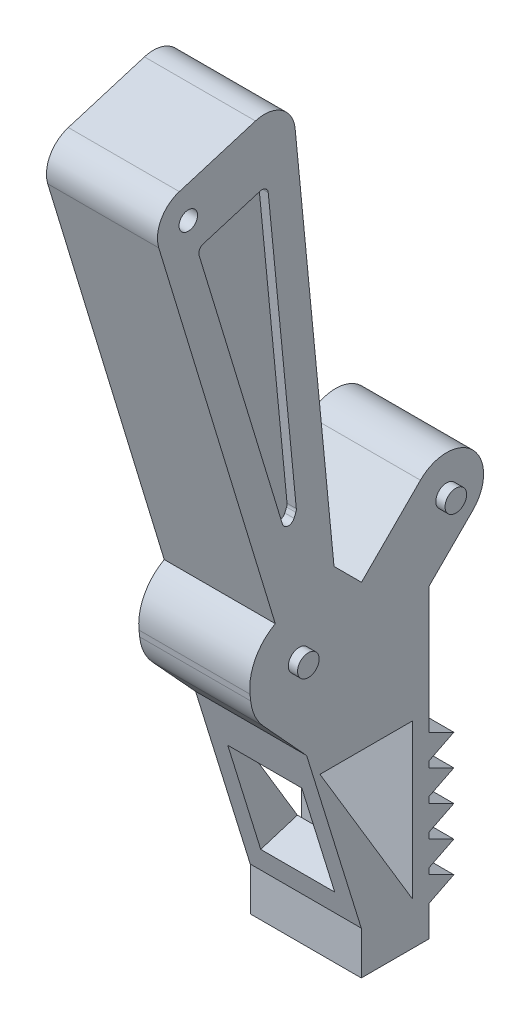
from build123d import *

# Parameters (mm, degrees)
BOSS_EXTRUDE1_DEPTH = 9
CUT_EXTRUDE1_DEPTH  = 25
BOSS_EXTRUDE2_DEPTH = 18
LPATTERN1_COUNT     = 5
LPATTERN1_PITCH     = 5
FILLET2_R           = 8
FILLET3_R           = 5
SKETCH6_R           = 1.5
CUT_EXTRUDE2_DEPTH  = 25
SKETCH7_W           = 12
SKETCH7_H           = 18.094661032
CUT_EXTRUDE3_DEPTH  = 8
SKETCH8_R           = 1.75
BOSS_EXTRUDE3_DEPTH = 1.5
SKETCH12_R          = 1.75
BOSS_EXTRUDE4_DEPTH = 1.5
CUT_EXTRUDE6_DEPTH  = 1.5


with BuildPart() as part:
    # Sketch3 → Boss-Extrude1 (new, symmetric)
    with BuildSketch(Plane(origin=(0, 0, 0), x_dir=(0, 0, -1), z_dir=(1, 0, 0))):
        with BuildLine():
            Line((49.79657451, 66.979899518), (70.136020437, 0))
            Line((70.136020437, 0), (65.359063047, -1.476711918))
            Line((65.359063047, -1.476711918), (66.429336182, -11.476711918))
            Line((66.429336182, -11.476711918), (75.217896234, -21.055919203))
            Line((75.217896234, -21.055919203), (84.07816774, -49.717663547))
            Line((84.07816774, -49.717663547), (84.07816774, -56.717663547))
            Line((84.07816774, -56.717663547), (95.07816774, -56.717663547))
            Line((95.07816774, -56.717663547), (95.07816774, -7.178658436))
            Line((95.07816774, -7.178658436), (102.149235552, -0.107590624))
            ThreePointArc((102.149235552, -0.107590624), (102.149235552, 8.37769075), (93.663954178, 8.37769075))
            Line((93.663954178, 8.37769075), (84.110365879, -1.175897549))
            Line((84.110365879, -1.175897549), (79.658453904, 3.276014426))
            Line((79.658453904, 3.276014426), (72.761111488, 73.953423835))
            Line((72.761111488, 73.953423835), (49.79657451, 66.979899518))
        make_face()
    extrude(amount=BOSS_EXTRUDE1_DEPTH, both=True)

    # Sketch4 → Cut-Extrude1 (cut)
    with BuildSketch(Plane(origin=(9, 0, 0), x_dir=(0, 0, -1), z_dir=(1, 0, 0))):
        Polygon((92.37816774, -49.772884049), (92.37816774, -24.772884049), (77.37816774, -24.772884049), align=None)
    extrude(amount=-CUT_EXTRUDE1_DEPTH, mode=Mode.SUBTRACT)

    # Sketch5 → Boss-Extrude2 (add)
    with BuildSketch(Plane(origin=(9, 0, 0), x_dir=(0, 0, -1), z_dir=(1, 0, 0))):
        Polygon((95.07816774, -47.717663547), (95.07816774, -49.717663547), (99.07816774, -49.717663547), align=None)
        Polygon((99.07816774, -49.717663547), (95.07816774, -49.717663547), (95.07816774, -51.717663547), align=None)
    boss_extrude2 = extrude(amount=-BOSS_EXTRUDE2_DEPTH)

    # LPattern1: Boss-Extrude2 ×5
    with Locations(*[(0, i * LPATTERN1_PITCH, 0) for i in range(1, LPATTERN1_COUNT)]):
        add(boss_extrude2)

    # Fillet2
    # the kernel refuses this fillet: 8 mm, written as the material it takes off along each edge
    with BuildSketch(Plane(origin=(-15.580741663, -11.476711918, -66.429336182), x_dir=(0, 0.9943213171006763, 0.10641953936743088), z_dir=(1, 0, 0))) as fillet2_piece_1:
        with BuildLine():
            CenterArc((FILLET2_R * 0.329037083141, -FILLET2_R), FILLET2_R, 90, 36.426245441)
            Line((-FILLET2_R * 0.264750438373, -FILLET2_R * 0.195378114085), (-FILLET2_R * 0.276626188803, -FILLET2_R * 0.179285676366))
            Line((-FILLET2_R * 0.276626188803, -FILLET2_R * 0.179285676366), (-FILLET2_R * 0.00658074166282, FILLET2_R * 0.02))
            Line((-FILLET2_R * 0.00658074166282, FILLET2_R * 0.02), (FILLET2_R * 0.329037083141, FILLET2_R * 0.02))
            Line((FILLET2_R * 0.329037083141, FILLET2_R * 0.02), (FILLET2_R * 0.329037083141, 0))
        make_face()
    extrude(amount=31.161483326, mode=Mode.SUBTRACT)
    with BuildSketch(Plane(origin=(-25.044809619, -1.476711918, -65.359063047), x_dir=(0, 0.2953423835382918, -0.9553914781313054), z_dir=(1, 0, 0))) as fillet2_piece_2:
        with BuildLine():
            CenterArc((6.618974651, -7.834470057), FILLET2_R, 101.675691656, 67.255197487)
            Line((-1.232195855, -6.298526803), (-1.389219265, -6.267807938))
            Line((-1.389219265, -6.267807938), (-0.15702341, 0.030718865))
            Line((-0.15702341, 0.030718865), (0, 0.16))
            ThreePointArc((0, 0.16), (2.5, 0.16), (4.967620507, 0.156689401))
            Line((4.967620507, 0.156689401), (5, 0))
        make_face()
    extrude(amount=50.089619238, mode=Mode.SUBTRACT)

    # Fillet3
    fillet3_edges = [part.edges().sort_by_distance(p)[0] for p in [
        (0, 66.979899518, -49.79657451),
        (0, 73.953423835, -72.761111488),
    ]]
    fillet(fillet3_edges, radius=FILLET3_R)

    # Sketch6 → Cut-Extrude2 (cut)
    with BuildSketch(Plane(origin=(9, 0, 0), x_dir=(0, 0, -1), z_dir=(1, 0, 0))):
        with Locations((56.033670614, 63.648438547)):
            Circle(SKETCH6_R)
    extrude(amount=-CUT_EXTRUDE2_DEPTH, mode=Mode.SUBTRACT)

    # Sketch7 → Cut-Extrude3 (cut)
    with BuildSketch(Plane(origin=(0, 19.387405719, -62.715557398), x_dir=(1, 0, 0), z_dir=(0, -0.29534238353829306, 0.955391478131305))):
        with Locations((0, -58.879009045)):
            Rectangle(SKETCH7_W, SKETCH7_H)
    extrude(amount=-CUT_EXTRUDE3_DEPTH, mode=Mode.SUBTRACT)

    # Sketch8 → Boss-Extrude3 (add)
    with BuildSketch(Plane(origin=(9, 0, 0), x_dir=(0, 0, -1), z_dir=(1, 0, 0))):
        with Locations((97.906594865, 4.135050063)):
            Circle(SKETCH8_R)
    boss_extrude3 = extrude(amount=BOSS_EXTRUDE3_DEPTH)

    # Sketch12 → Boss-Extrude4 (add)
    with BuildSketch(Plane(origin=(9, 0, 0), x_dir=(0, 0, -1), z_dir=(1, 0, 0))):
        with Locations((73.996626083, -7.006834096)):
            Circle(SKETCH12_R)
    boss_extrude4 = extrude(amount=BOSS_EXTRUDE4_DEPTH)

    # Sketch13 → Cut-Extrude6 (cut)
    with BuildSketch(Plane(origin=(9, 0, 0), x_dir=(0, 0, -1), z_dir=(1, 0, 0))):
        with BuildLine():
            Line((73.173071484, 13.27485534), (73.467077668, 13.955552183))
            ThreePointArc((73.467077668, 13.955552183), (73.53702701, 14.197471144), (73.544321074, 14.449194188))
            Line((73.544321074, 14.449194188), (68.990982491, 61.107480203))
            ThreePointArc((68.990982491, 61.107480203), (68.551531185, 61.841654795), (67.705147046, 61.967208252))
            Line((67.705147046, 61.967208252), (58.443343887, 59.154723523))
            ThreePointArc((58.443343887, 59.154723523), (57.851848811, 58.669007544), (57.777051693, 57.907304302))
            Line((57.777051693, 57.907304302), (71.298187251, 13.380806172))
            ThreePointArc((71.298187251, 13.380806172), (72.198622375, 12.672962595), (73.173071484, 13.27485534))
        make_face()
    cut_extrude6 = extrude(amount=-CUT_EXTRUDE6_DEPTH, mode=Mode.SUBTRACT)

    # Mirror1: Boss-Extrude3, Boss-Extrude4, Cut-Extrude6 across plane
    add(boss_extrude3.mirror(Plane(origin=(0, 0, 0), x_dir=(0, 0, 1), z_dir=(1, 0, 0))))
    add(boss_extrude4.mirror(Plane(origin=(0, 0, 0), x_dir=(0, 0, 1), z_dir=(1, 0, 0))))
    add(cut_extrude6.mirror(Plane(origin=(0, 0, 0), x_dir=(0, 0, 1), z_dir=(1, 0, 0))), mode=Mode.SUBTRACT)


solid = part.part
